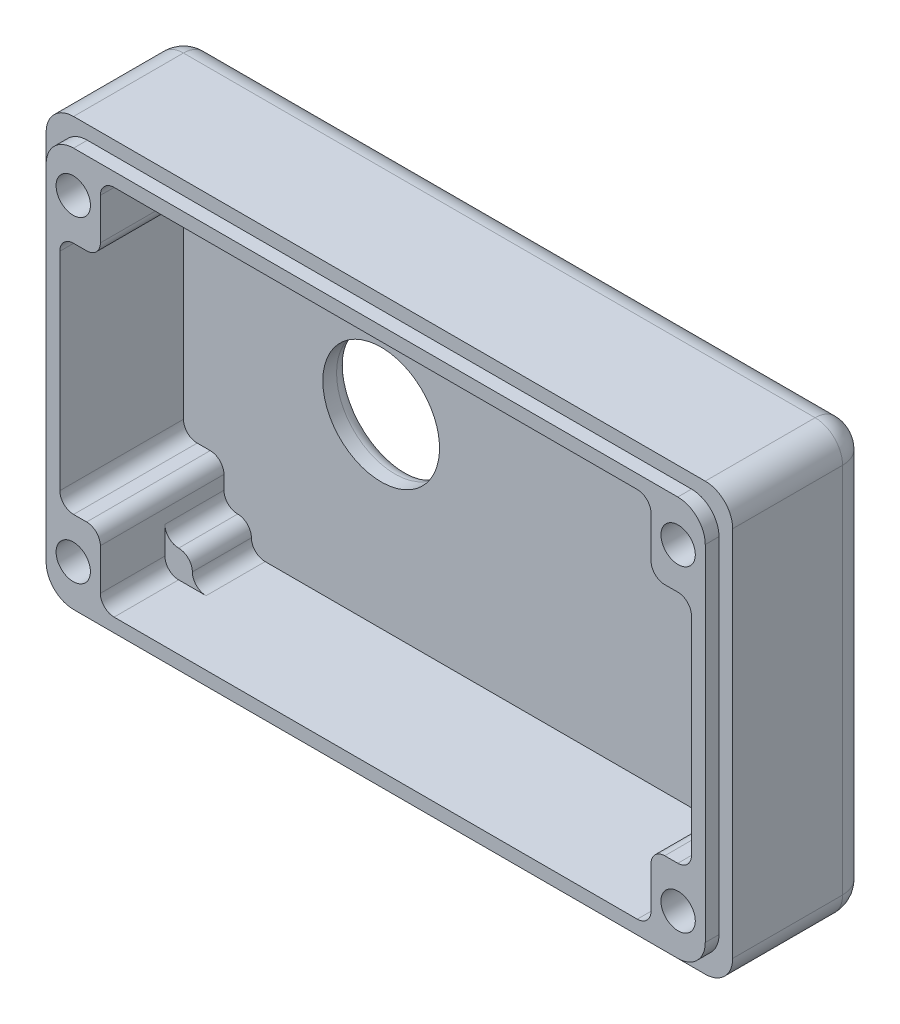
from build123d import *

# Parameters (mm, degrees)
SKETCH1_W           = 50
SKETCH1_H           = 31.1
BOSS_EXTRUDE1_DEPTH = 11
SKETCH2_W           = 46
SKETCH2_H           = 27.1
CUT_EXTRUDE1_DEPTH  = 9
SKETCH3_R           = 4.25
CUT_EXTRUDE2_DEPTH  = 2
FILLET1_R           = 1
SKETCH4_W           = 50
SKETCH4_H           = 31.1
SKETCH4_W_2         = 48
SKETCH4_H_2         = 29.1
CUT_EXTRUDE3_DEPTH  = 1
SKETCH5_W           = 2.95
SKETCH5_H           = 5
BOSS_EXTRUDE2_DEPTH = 9
SKETCH6_R           = 1.25
CUT_EXTRUDE4_DEPTH  = 8
FILLET2_R           = 2
SKETCH7_W           = 2
SKETCH7_H           = 2
BOSS_EXTRUDE3_DEPTH = 4.3
FILLET3_R           = 1


with BuildPart() as part:
    # Sketch1 → Boss-Extrude1 (new body)
    with BuildSketch(Plane.XY):
        Rectangle(SKETCH1_W, SKETCH1_H)
    extrude(amount=BOSS_EXTRUDE1_DEPTH)

    # Sketch2 → Cut-Extrude1 (cut)
    with BuildSketch(Plane.XY.offset(11)):
        Rectangle(SKETCH2_W, SKETCH2_H)
    extrude(amount=-CUT_EXTRUDE1_DEPTH, mode=Mode.SUBTRACT)

    # Sketch3 → Cut-Extrude2 (cut)
    with BuildSketch(Plane(origin=(0, 0, 0), x_dir=(-1, 0, 0), z_dir=(0, 0, -1))):
        with Locations((8.6, -0.05)):
            Circle(SKETCH3_R)
    extrude(amount=-CUT_EXTRUDE2_DEPTH, mode=Mode.SUBTRACT)

    # Fillet1
    fillet1_edges = [part.edges().sort_by_distance(p)[0] for p in [
        (-4.35, -0.05, 0),
    ]]
    fillet(fillet1_edges, radius=FILLET1_R)

    # Sketch4 → Cut-Extrude3 (cut)
    with BuildSketch(Plane.XY.offset(11)):
        Rectangle(SKETCH4_W, SKETCH4_H)
        Rectangle(SKETCH4_W_2, SKETCH4_H_2, mode=Mode.SUBTRACT)
    extrude(amount=-CUT_EXTRUDE3_DEPTH, mode=Mode.SUBTRACT)

    # Sketch5 → Boss-Extrude2 (add)
    with BuildSketch(Plane.XY.offset(2)):
        with Locations((-21.525, 11.05)):
            Rectangle(SKETCH5_W, SKETCH5_H)
        with Locations((21.525, 11.05)):
            Rectangle(SKETCH5_W, SKETCH5_H)
        with Locations((-21.525, -11.05)):
            Rectangle(SKETCH5_W, SKETCH5_H)
        with Locations((21.525, -11.05)):
            Rectangle(SKETCH5_W, SKETCH5_H)
    extrude(amount=BOSS_EXTRUDE2_DEPTH)

    # Sketch6 → Cut-Extrude4 (cut)
    with BuildSketch(Plane.XY.offset(11)):
        with Locations((-22.025, 11.55)):
            Circle(SKETCH6_R)
        with Locations(Location((22.025, 11.55, 0), (0, 0, 180))):
            Circle(SKETCH6_R)
        with Locations(Location((-22.025, -11.55, 0), (0, 0, 180))):
            Circle(SKETCH6_R)
        with Locations((22.025, -11.55)):
            Circle(SKETCH6_R)
    extrude(amount=-CUT_EXTRUDE4_DEPTH, mode=Mode.SUBTRACT)

    # Fillet2
    fillet2_edges = [part.edges().sort_by_distance(p)[0] for p in [
        (25, -15.55, 5),
        (-25, -15.55, 5),
        (-25, 15.55, 5),
        (25, 15.55, 5),
        (24, -14.55, 10.5),
        (0, -15.55, 0),
        (-24, -14.55, 10.5),
        (-24, 14.55, 10.5),
        (24, 14.55, 10.5),
        (-25, 0, 0),
        (0, 15.55, 0),
        (25, 0, 0),
    ]]
    fillet(fillet2_edges, radius=FILLET2_R)

    # Sketch7 → Boss-Extrude3 (add)
    with BuildSketch(Plane.XY.offset(2)):
        with Locations((-19.05, 12.55)):
            Rectangle(SKETCH7_W, SKETCH7_H)
        with Locations((19.05, 12.55)):
            Rectangle(SKETCH7_W, SKETCH7_H)
        with Locations((19.05, -12.55)):
            Rectangle(SKETCH7_W, SKETCH7_H)
        with Locations((-19.05, -12.55)):
            Rectangle(SKETCH7_W, SKETCH7_H)
    extrude(amount=BOSS_EXTRUDE3_DEPTH)

    # Fillet3
    fillet3_edges = [part.edges().sort_by_distance(p)[0] for p in [
        (23, 8.55, 6.5),
        (20.05, 8.55, 6.5),
        (20.05, 13.55, 8.65),
        (-20.05, 13.55, 8.65),
        (-23, 8.55, 6.5),
        (-23, -8.55, 6.5),
        (-20.05, -8.55, 6.5),
        (-20.05, -13.55, 8.65),
        (20.05, -13.55, 8.65),
        (20.05, -8.55, 6.5),
        (23, -8.55, 6.5),
        (-20.05, 8.55, 6.5),
        (-18.05, -11.55, 4.15),
        (-20.05, -11.55, 4.15),
        (-18.05, 11.55, 4.15),
        (-18.05, 13.55, 4.15),
        (18.05, 13.55, 4.15),
        (18.05, 11.55, 4.15),
        (20.05, 11.55, 4.15),
        (20.05, -11.55, 4.15),
        (18.05, -11.55, 4.15),
        (18.05, -13.55, 4.15),
        (-18.05, -13.55, 4.15),
        (-20.05, 11.55, 4.15),
    ]]
    fillet(fillet3_edges, radius=FILLET3_R - 0.0001)  # a hair under: the kernel refuses the full size


solid = part.part
